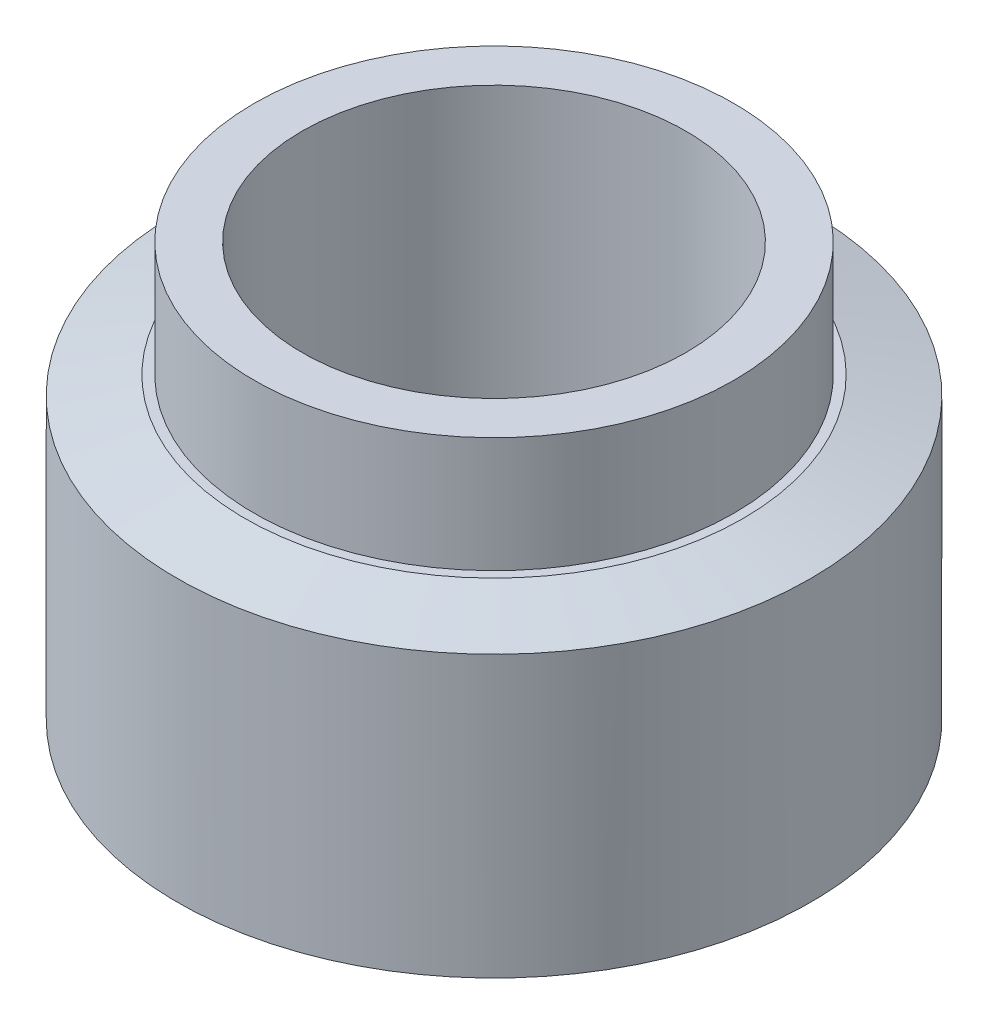
from build123d import *

# Parameters (mm, degrees)
CHAMFER_2_SIZE           = 0.705
CHAMFER_2_SIZE2          = 0.188904181
CHAMFER_3_SIZE           = 0.705
CHAMFER_3_SIZE2          = 0.188904181
CUT_EXTRUDE_2_DEPTH      = 7.483054835
CUT_EXTRUDE_2_DEPTH_BACK = 7.483054835
SKETCH_4_R               = 2


with BuildPart() as part:
    # Эскиз2 → Повернуть2 (revolve)
    with BuildSketch(Plane.XY):
        Polygon((0, 0), (3.3, 0), (3.3, 3.3), (2.5, 3.3), (2.5, 4.5), (0, 4.5), align=None)
    revolve(axis=Axis((0, 4.5, 0), (0, -1, 0)))

    # Фаска2
    chamfer_2_edges = [part.edges().sort_by_distance(p)[0] for p in [
        (-3.3, 3.3, 0),
    ]]
    chamfer_2_side = [part.faces().sort_by_distance(p)[0] for p in [
        (-3.206661905, 3.3, 0),
    ]]
    chamfer(chamfer_2_edges, length=CHAMFER_2_SIZE, length2=CHAMFER_2_SIZE2, reference=chamfer_2_side[0])

    # Фаска3
    chamfer_3_edges = [part.edges().sort_by_distance(p)[0] for p in [
        (-3.3, 0, 0),
    ]]
    chamfer_3_side = [part.faces().sort_by_distance(p)[0] for p in [
        (0, 0, 0),
    ]]
    chamfer(chamfer_3_edges, length=CHAMFER_3_SIZE, length2=CHAMFER_3_SIZE2, reference=chamfer_3_side[0])

    # Эскиз4 → Вырез-Вытянуть2 (cut, two sides: drawn at the far end of the back side and taken through both)
    with BuildSketch(Plane(origin=(0, 4.5, 0), x_dir=(1, 0, 0), z_dir=(0, 1, 0)).offset(-CUT_EXTRUDE_2_DEPTH_BACK)):
        Circle(SKETCH_4_R)
    extrude(amount=CUT_EXTRUDE_2_DEPTH + CUT_EXTRUDE_2_DEPTH_BACK, mode=Mode.SUBTRACT)


solid = part.part
